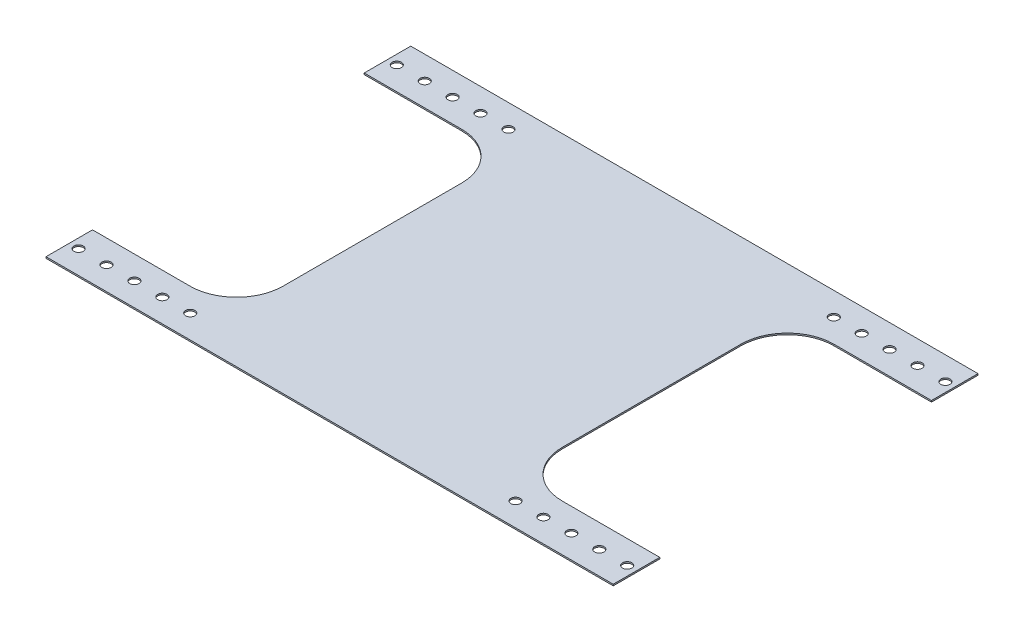
from build123d import *

# Parameters (mm, degrees)
SHEET_DEPTH             = 0.79375
SKETCH4_R               = 2.5
MOUNTHOLES_DEPTH        = 182.191583798
MIRROR4_COPY_1_SKETCH_R = 2.5
MIRROR4_COPY_1_DEPTH    = 182.191583798
MIRROR4_COPY_2_SKETCH_R = 2.5
MIRROR4_COPY_2_DEPTH    = 182.191583798


with BuildPart() as part:
    # Sketch3 → Sheet (new body)
    with BuildSketch(Plane(origin=(0, 0, 0), x_dir=(1, 0, 0), z_dir=(0, 1, 0))):
        with BuildLine():
            Line((-152.4, 98), (152.4, 98))
            Line((152.4, 98), (152.4, 73))
            Line((152.4, 73), (100, 73))
            ThreePointArc((100, 73), (82.32233047, 65.67766953), (75, 48))
            Line((75, 48), (75, -48))
            ThreePointArc((75, -48), (82.32233047, -65.67766953), (100, -73))
            Line((100, -73), (152.4, -73))
            Line((152.4, -73), (152.4, -98))
            Line((152.4, -98), (-152.4, -98))
            Line((-152.4, -98), (-152.4, -73))
            Line((-152.4, -73), (-100, -73))
            ThreePointArc((-100, -73), (-82.32233047, -65.67766953), (-75, -48))
            Line((-75, -48), (-75, 48))
            ThreePointArc((-75, 48), (-82.32233047, 65.67766953), (-100, 73))
            Line((-100, 73), (-152.4, 73))
            Line((-152.4, 73), (-152.4, 98))
        make_face()
    extrude(amount=SHEET_DEPTH)

    # Sketch4 → MountHoles (cut, through all)
    with BuildSketch(Plane(origin=(0, 0.79375, 0), x_dir=(1, 0, 0), z_dir=(0, 1, 0))):
        with Locations((-147.4, 85.5)):
            Circle(SKETCH4_R)
        with Locations((-132.4, 85.5)):
            Circle(SKETCH4_R)
        with Locations((-117.4, 85.5)):
            Circle(SKETCH4_R)
        with Locations((-102.4, 85.5)):
            Circle(SKETCH4_R)
        with Locations((-87.4, 85.5)):
            Circle(SKETCH4_R)
    mountholes = extrude(amount=-MOUNTHOLES_DEPTH, mode=Mode.SUBTRACT)

    # Mirror3: MountHoles across plane
    add(mountholes.mirror(Plane.XY), mode=Mode.SUBTRACT)

    # Mirror4 copy 1 sketch → Mirror4 copy 1 (cut, through all)
    with BuildSketch(Plane(origin=(0, 0.79375, 0), x_dir=(-1, 0, 0), z_dir=(0, 1, 0))):
        with Locations((-147.4, 85.5)):
            Circle(MIRROR4_COPY_1_SKETCH_R)
        with Locations((-132.4, 85.5)):
            Circle(MIRROR4_COPY_1_SKETCH_R)
        with Locations((-117.4, 85.5)):
            Circle(MIRROR4_COPY_1_SKETCH_R)
        with Locations((-102.4, 85.5)):
            Circle(MIRROR4_COPY_1_SKETCH_R)
        with Locations((-87.4, 85.5)):
            Circle(MIRROR4_COPY_1_SKETCH_R)
    extrude(amount=-MIRROR4_COPY_1_DEPTH, mode=Mode.SUBTRACT)

    # Mirror4 copy 2 sketch → Mirror4 copy 2 (cut, through all)
    with BuildSketch(Plane(origin=(0, 0.79375, 0), x_dir=(-1, 0, 0), z_dir=(0, 1, 0))):
        with Locations((-147.4, -85.5)):
            Circle(MIRROR4_COPY_2_SKETCH_R)
        with Locations((-132.4, -85.5)):
            Circle(MIRROR4_COPY_2_SKETCH_R)
        with Locations((-117.4, -85.5)):
            Circle(MIRROR4_COPY_2_SKETCH_R)
        with Locations((-102.4, -85.5)):
            Circle(MIRROR4_COPY_2_SKETCH_R)
        with Locations((-87.4, -85.5)):
            Circle(MIRROR4_COPY_2_SKETCH_R)
    extrude(amount=-MIRROR4_COPY_2_DEPTH, mode=Mode.SUBTRACT)


solid = part.part
